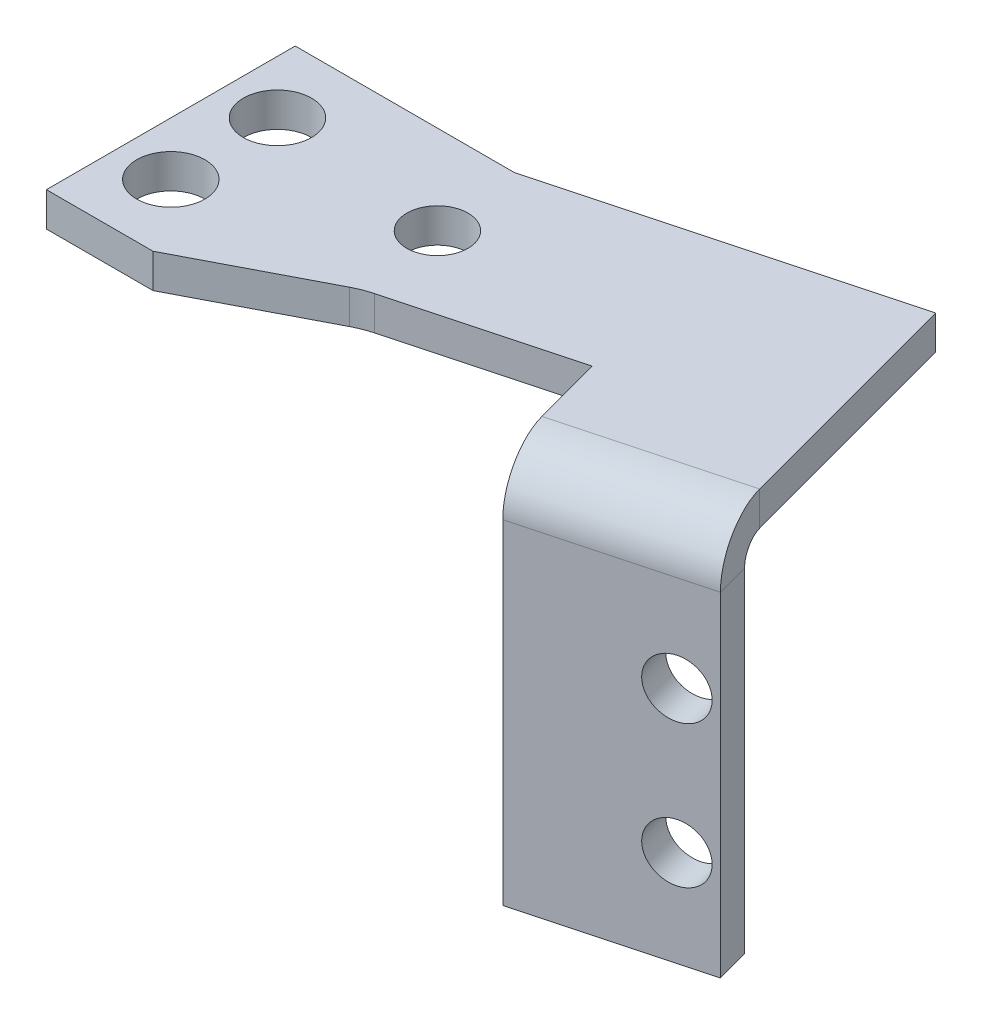
from build123d import *

# Parameters (mm, degrees)
BASE_FLANGE1_DEPTH              = 1.2192
HOLE1_START                     = -1.2192
HOLE1_OUTLINE_R                 = 1.0922
HOLE1_DEPTH                     = 1.2192
EDGE_FLANGE1_DEPTH              = 6.35
F_1_CLEARANCE_HOLE2_D           = 2.0574
F_1_CLEARANCE_HOLE2_ON_FACE_2_D = 2.0574
F_2_CLEARANCE_HOLE2_D           = 2.4384


# Read off the part's stored shape, not the designer's step: Hole1
# Sheet-metal steps are written as plain solids
with BuildPart() as part:
    # Sketch1 → Base-Flange1 (new body)
    with BuildSketch(Plane(origin=(0, 0, 0), x_dir=(1, 0, 0), z_dir=(0, 1, 0))):
        with BuildLine():
            Line((4.02700332, 6.35), (15.890507526, 9.528816371))
            Line((15.890507526, 9.528816371), (17.534008462, 3.395187374))
            Line((17.534008462, 3.395187374), (5.266750468, 0.108185502))
            ThreePointArc((5.266750468, 0.108185502), (4.939943157, 0.001343981), (4.626605284, -0.140209919))
            Line((4.626605284, -0.140209919), (0, -2.54))
            Line((0, -2.54), (-3.81, -2.54))
            Line((-3.81, -2.54), (-3.81, 6.35))
            Line((-3.81, 6.35), (4.02700332, 6.35))
        make_face()
    extrude(amount=-BASE_FLANGE1_DEPTH)

    # Hole1 outline → Hole1 (cut)
    with BuildSketch(Plane(origin=(0, 0, 0), x_dir=(1, 0, 0), z_dir=(0, 1, 0)).offset(HOLE1_START)):
        with Locations((4.445, 3.175)):
            Circle(HOLE1_OUTLINE_R)
    extrude(amount=HOLE1_DEPTH, mode=Mode.SUBTRACT)

    # Edge-Flange1 section (across the edge) → Edge-Flange1 (add)
    with BuildSketch(Plane(origin=(18.388628949, -1.2192, -0.205700296), x_dir=(-0.2588190451025216, -3.4914813388431334e-15, -0.9659258262890682), z_dir=(-0.9659258262890682, 0, 0.2588190451025216))):
        with BuildLine():
            Line((-1.2192, 0.762), (-1.2192, 12.7))
            Line((-1.2192, 12.7), (0, 12.7))
            Line((0, 12.7), (0, 0.762))
            ThreePointArc((0, 0.762), (0.223184633, 0.223184633), (0.762, 0))
            Line((0.762, 0), (3.302, 0))
            Line((3.302, 0), (3.302, -1.2192))
            Line((3.302, -1.2192), (0.762, -1.2192))
            ThreePointArc((0.762, -1.2192), (-0.638919955, -0.638919955), (-1.2192, 0.762))
        make_face()
    extrude(amount=EDGE_FLANGE1_DEPTH)

    # #1 Clearance Hole2 (through all)
    with Locations(Plane(origin=(17.16190315, -10.4902, 0.122999891), x_dir=(-0.965925826289, 0, 0.258819045103), z_dir=(-0.258819045103, 0, -0.965925826289))):
        with Locations((0, 0)):
            Hole(F_1_CLEARANCE_HOLE2_D / 2)

    # #1 Clearance Hole2 on face 2 (through all)
    with Locations(Plane(origin=(17.16190315, -5.4102, 0.122999891), x_dir=(-0.965925849201, 0, 0.258818959594), z_dir=(-0.258818959594, 0, -0.965925849201))):
        with Locations((0, 0)):
            Hole(F_1_CLEARANCE_HOLE2_ON_FACE_2_D / 2)

    # #2 Clearance Hole2 (through all)
    with Locations(Plane(origin=(0, 0, 0), x_dir=(1, 0, 0), z_dir=(0, 1, 0))):
        with Locations((-1.905, 0), (-1.905, 3.81)):
            Hole(F_2_CLEARANCE_HOLE2_D / 2)


solid = part.part
